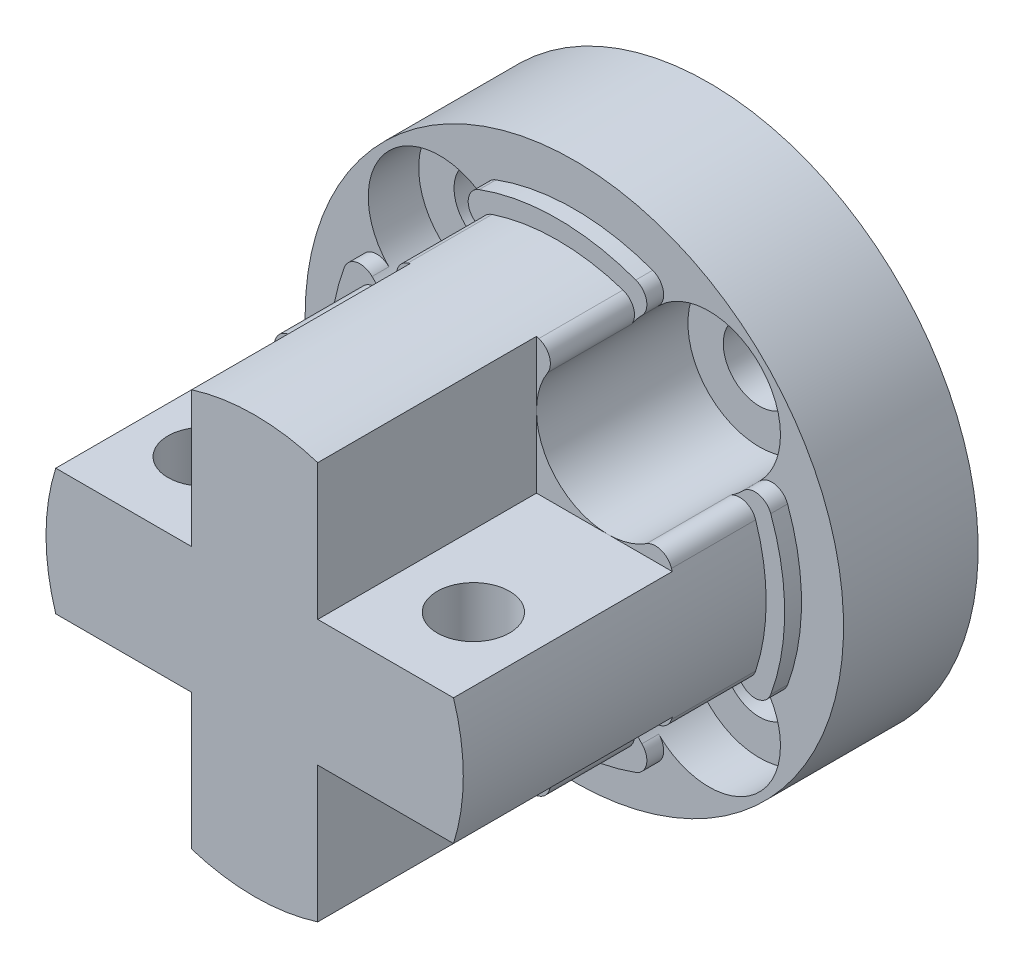
from build123d import *

# Parameters (mm, degrees)
SKETCH1_W               = 2.7
SKETCH1_H               = 2
CUT_EXTRUDE1_DEPTH      = 25
CUT_EXTRUDE1_DEPTH_BACK = 25
SKETCH2_R               = 2.15
CUT_EXTRUDE3_DEPTH      = 25
CUT_EXTRUDE3_DEPTH_BACK = 3
SKETCH2_4_R             = 4.25
BOSS_EXTRUDE1_DEPTH     = 1
SKETCH4_W               = 7.5
SKETCH4_H               = 7.5
BOSS_EXTRUDE2_DEPTH     = 13
FILLET1_START           = 9
FILLET1_DEPTH           = 5
FILLET2_R               = 1
CUT_EXTRUDE4_REACH      = 39.082
SKETCH5_R               = 2.15


with BuildPart() as part:
    # Sketch1 → Revolve1 (revolve)
    with BuildSketch(Plane(origin=(0, 0, 0), x_dir=(1, 0, 0), z_dir=(0, 1, 0)), mode=Mode.PRIVATE) as revolve1_sk:
        Polygon((16, 0), (2.7, 0), (2.7, -12), (2.7, -14), (12.4, -14), (12.4, -8), (16, -8), align=None)
        with Locations((1.35, -13)):
            Rectangle(SKETCH1_W, SKETCH1_H)
    revolve(revolve1_sk.sketch.rotate(Axis((0, 0, 0), (0, 0, 1)), 180), axis=Axis((0, 0, 0), (0, 0, 1)))

    # Sketch2 → Cut-Extrude1 (cut, two sides: drawn at the far end of the back side and taken through both)
    with BuildSketch(Plane.XY.offset(8).offset(-CUT_EXTRUDE1_DEPTH_BACK)):
        with Locations((-8, 8)):
            Circle(SKETCH2_R)
        with Locations((8, 8)):
            Circle(SKETCH2_R)
        with Locations((8, -8)):
            Circle(SKETCH2_R)
        with Locations((-8, -8)):
            Circle(SKETCH2_R)
    extrude(amount=CUT_EXTRUDE1_DEPTH + CUT_EXTRUDE1_DEPTH_BACK, mode=Mode.SUBTRACT)

    # Sketch2<4> → Cut-Extrude3 (cut, two sides: drawn at the far end of the back side and taken through both)
    with BuildSketch(Plane.XY.offset(8).offset(-CUT_EXTRUDE3_DEPTH_BACK)):
        with Locations((-8, 8)):
            Circle(SKETCH2_4_R)
        with Locations((8, 8)):
            Circle(SKETCH2_4_R)
        with Locations((8, -8)):
            Circle(SKETCH2_4_R)
        with Locations((-8, -8)):
            Circle(SKETCH2_4_R)
    extrude(amount=CUT_EXTRUDE3_DEPTH + CUT_EXTRUDE3_DEPTH_BACK, mode=Mode.SUBTRACT)

    # Sketch3 → Boss-Extrude1 (add)
    with BuildSketch(Plane.XY.offset(8)):
        with BuildLine():
            ThreePointArc((5.244985625, 11.236108125), (5.769768323, 11.617812415), (6.346544904, 11.915173846))
            ThreePointArc((6.346544904, 11.915173846), (0, 13.5), (-6.346544904, 11.915173846))
            ThreePointArc((-6.346544904, 11.915173846), (-5.769768323, 11.617812415), (-5.244985625, 11.236108125))
            ThreePointArc((-5.244985625, 11.236108125), (0, 12.4), (5.244985625, 11.236108125))
        make_face()
        with BuildLine():
            ThreePointArc((-11.236108125, 5.244985625), (-11.617812415, 5.769768323), (-11.915173846, 6.346544904))
            ThreePointArc((-11.915173846, 6.346544904), (-13.5, 0), (-11.915173846, -6.346544904))
            ThreePointArc((-11.915173846, -6.346544904), (-11.617812415, -5.769768323), (-11.236108125, -5.244985625))
            ThreePointArc((-11.236108125, -5.244985625), (-12.4, 0), (-11.236108125, 5.244985625))
        make_face()
        with BuildLine():
            ThreePointArc((-6.346544904, -11.915173846), (0, -13.5), (6.346544904, -11.915173846))
            ThreePointArc((6.346544904, -11.915173846), (5.769768323, -11.617812415), (5.244985625, -11.236108125))
            ThreePointArc((5.244985625, -11.236108125), (0, -12.4), (-5.244985625, -11.236108125))
            ThreePointArc((-5.244985625, -11.236108125), (-5.769768323, -11.617812415), (-6.346544904, -11.915173846))
        make_face()
        with BuildLine():
            ThreePointArc((11.915173846, -6.346544904), (13.097802238, -3.270714989), (13.5, 0))
            ThreePointArc((13.5, 0), (13.097802238, 3.270714989), (11.915173846, 6.346544904))
            ThreePointArc((11.915173846, 6.346544904), (11.617812415, 5.769768323), (11.236108125, 5.244985625))
            ThreePointArc((11.236108125, 5.244985625), (12.4, 0), (11.236108125, -5.244985625))
            ThreePointArc((11.236108125, -5.244985625), (11.617812415, -5.769768323), (11.915173846, -6.346544904))
        make_face()
    extrude(amount=BOSS_EXTRUDE1_DEPTH)

    # Sketch4 → Boss-Extrude2 (add)
    with BuildSketch(Plane.XY.offset(14)):
        with BuildLine():
            Line((-3.75, 11.819369696), (-3.75, 3.75))
            Line((-3.75, 3.75), (3.75, 3.75))
            Line((3.75, 3.75), (3.75, 11.819369696))
            ThreePointArc((3.75, 11.819369696), (0, 12.4), (-3.75, 11.819369696))
        make_face()
        Rectangle(SKETCH4_W, SKETCH4_H)
        with BuildLine():
            Line((-3.75, 3.75), (-11.819369696, 3.75))
            ThreePointArc((-11.819369696, 3.75), (-12.4, 0), (-11.819369696, -3.75))
            Line((-11.819369696, -3.75), (-3.75, -3.75))
            Line((-3.75, -3.75), (-3.75, 3.75))
        make_face()
        with BuildLine():
            Line((3.75, -3.75), (-3.75, -3.75))
            Line((-3.75, -3.75), (-3.75, -11.819369696))
            ThreePointArc((-3.75, -11.819369696), (0, -12.4), (3.75, -11.819369696))
            Line((3.75, -11.819369696), (3.75, -3.75))
        make_face()
        with BuildLine():
            Line((11.819369696, 3.75), (3.75, 3.75))
            Line((3.75, 3.75), (3.75, -3.75))
            Line((3.75, -3.75), (11.819369696, -3.75))
            ThreePointArc((11.819369696, -3.75), (12.253982704, -1.897342322), (12.4, 0))
            ThreePointArc((12.4, 0), (12.253982704, 1.897342322), (11.819369696, 3.75))
        make_face()
    extrude(amount=BOSS_EXTRUDE2_DEPTH)

    # Fillet1: read off the stored shape, not the designer's step
    # Fillet1 outline → Fillet1 (cut)
    with BuildSketch(Plane.XY.offset(FILLET1_START)):
        with BuildLine():
            ThreePointArc((-10.286897346, -4.417738071), (-11.160201718, -4.516996035), (-11.774551439, -3.8884365))
            ThreePointArc((-11.774551439, -3.8884365), (-11.525305626, -4.574639902), (-11.236108125, -5.244985625))
            ThreePointArc((-11.236108125, -5.244985625), (-10.792307645, -4.796015291), (-10.286897346, -4.417738071))
        make_face()
        with BuildLine():
            ThreePointArc((-11.236108125, 5.244985625), (-11.525305626, 4.574639902), (-11.774551439, 3.8884365))
            ThreePointArc((-11.774551439, 3.8884365), (-11.160201718, 4.516996035), (-10.286897346, 4.417738071))
            ThreePointArc((-10.286897346, 4.417738071), (-10.792307645, 4.796015291), (-11.236108125, 5.244985625))
        make_face()
        with BuildLine():
            ThreePointArc((-4.417738071, -10.286897346), (-4.796015291, -10.792307645), (-5.244985625, -11.236108125))
            ThreePointArc((-5.244985625, -11.236108125), (-4.574639902, -11.525305626), (-3.8884365, -11.774551439))
            ThreePointArc((-3.8884365, -11.774551439), (-4.516996035, -11.160201718), (-4.417738071, -10.286897346))
        make_face()
        with BuildLine():
            ThreePointArc((-3.8884365, 11.774551439), (-4.574639902, 11.525305626), (-5.244985625, 11.236108125))
            ThreePointArc((-5.244985625, 11.236108125), (-4.796015291, 10.792307645), (-4.417738071, 10.286897346))
            ThreePointArc((-4.417738071, 10.286897346), (-4.516996035, 11.160201718), (-3.8884365, 11.774551439))
        make_face()
        with BuildLine():
            ThreePointArc((4.417738071, -10.286897346), (4.516996035, -11.160201718), (3.8884365, -11.774551439))
            ThreePointArc((3.8884365, -11.774551439), (4.574639902, -11.525305626), (5.244985625, -11.236108125))
            ThreePointArc((5.244985625, -11.236108125), (4.796015291, -10.792307645), (4.417738071, -10.286897346))
        make_face()
        with BuildLine():
            ThreePointArc((5.244985625, 11.236108125), (4.574639902, 11.525305626), (3.8884365, 11.774551439))
            ThreePointArc((3.8884365, 11.774551439), (4.516996035, 11.160201718), (4.417738071, 10.286897346))
            ThreePointArc((4.417738071, 10.286897346), (4.796015291, 10.792307645), (5.244985625, 11.236108125))
        make_face()
        with BuildLine():
            ThreePointArc((11.774551439, -3.8884365), (11.160201718, -4.516996035), (10.286897346, -4.417738071))
            ThreePointArc((10.286897346, -4.417738071), (10.792307645, -4.796015291), (11.236108125, -5.244985625))
            ThreePointArc((11.236108125, -5.244985625), (11.525305626, -4.574639902), (11.774551439, -3.8884365))
        make_face()
        with BuildLine():
            ThreePointArc((11.236108125, 5.244985625), (10.792307645, 4.796015291), (10.286897346, 4.417738071))
            ThreePointArc((10.286897346, 4.417738071), (11.160201718, 4.516996035), (11.774551439, 3.8884365))
            ThreePointArc((11.774551439, 3.8884365), (11.525305626, 4.574639902), (11.236108125, 5.244985625))
        make_face()
    extrude(amount=FILLET1_DEPTH, mode=Mode.SUBTRACT)

    # Fillet2
    # the kernel refuses this fillet: 1 mm, written as the material it takes off along each edge
    with BuildSketch(Plane(origin=(6.346544904, 11.915173846, 8), x_dir=(-0.9128071588111344, 0.4083908554597477, 0), z_dir=(0, 0, 1)), Plane(origin=(-11.915173846, 6.346544904, 8), x_dir=(-0.4083908554599063, -0.9128071588110634, 0), z_dir=(0, 0, 1)), Plane(origin=(-6.346544904, -11.915173846, 8), x_dir=(0.9128071588110586, -0.408390855459917, 0), z_dir=(0, 0, 1)), Plane(origin=(11.915173846, -6.346544904, 8), x_dir=(0.4083908554598645, 0.9128071588110821, 0), z_dir=(0, 0, 1))) as fillet2_piece_1:
        with BuildLine():
            CenterArc((1.785571343, 0.997639029), FILLET2_R, 158.772199303, 115.165734994)
            ThreePointArc((0.853423117, 1.359715932), (0.491495222, 0.639196623), (0, 0))
            ThreePointArc((0, 0), (0.927123582, -0.031873112), (1.854247164, 0))
        make_face()
    extrude(amount=5.63561791, mode=Mode.SUBTRACT)
    with BuildSketch(Plane(origin=(-6.346544904, 11.915173846, 8), x_dir=(0.9128071588110631, 0.4083908554599068, 0), z_dir=(0, 0, 1)), Plane(origin=(-11.915173846, -6.346544904, 8), x_dir=(-0.4083908554599002, 0.912807158811066, 0), z_dir=(0, 0, 1)), Plane(origin=(6.346544904, -11.915173846, 8), x_dir=(-0.9128071588111399, -0.40839085545973536, 0), z_dir=(0, 0, 1)), Plane(origin=(11.915173846, 6.346544904, 8), x_dir=(0.40839085545986265, -0.912807158811083, 0), z_dir=(0, 0, 1))) as fillet2_piece_2:
        with BuildLine():
            CenterArc((1.785571343, -0.997639029), FILLET2_R, 86.062065704, 115.165734994)
            ThreePointArc((0.853423117, -1.359715932), (0.491495222, -0.639196623), (0, 0))
            ThreePointArc((0, 0), (0.927123582, 0.031873112), (1.854247164, 0))
        make_face()
    extrude(amount=5.63561791, mode=Mode.SUBTRACT)

    # Sketch5 → Cut-Extrude4 (cut, up to next)
    with BuildSketch(Plane(origin=(0, 3.75, 0), x_dir=(1, 0, 0), z_dir=(0, 1, 0)), mode=Mode.PRIVATE) as cut_extrude4_sk1:
        with Locations(Location((-8, -22, 0), (0, 0, 270))):
            Circle(SKETCH5_R)
    cut_extrude4_tool1 = extrude(cut_extrude4_sk1.sketch, amount=-CUT_EXTRUDE4_REACH, mode=Mode.PRIVATE) & part.part
    # Sketch5 → Cut-Extrude4 (cut, up to next)
    with BuildSketch(Plane(origin=(0, 3.75, 0), x_dir=(1, 0, 0), z_dir=(0, 1, 0)), mode=Mode.PRIVATE) as cut_extrude4_sk2:
        with Locations(Location((8, -22, 0), (0, 0, 270))):
            Circle(SKETCH5_R)
    cut_extrude4_tool2 = extrude(cut_extrude4_sk2.sketch, amount=-CUT_EXTRUDE4_REACH, mode=Mode.PRIVATE) & part.part
    add(cut_extrude4_tool1.solids().sort_by_distance((-8, 3.75, 22))[0], mode=Mode.SUBTRACT)
    add(cut_extrude4_tool2.solids().sort_by_distance((8, 3.75, 22))[0], mode=Mode.SUBTRACT)


solid = part.part
